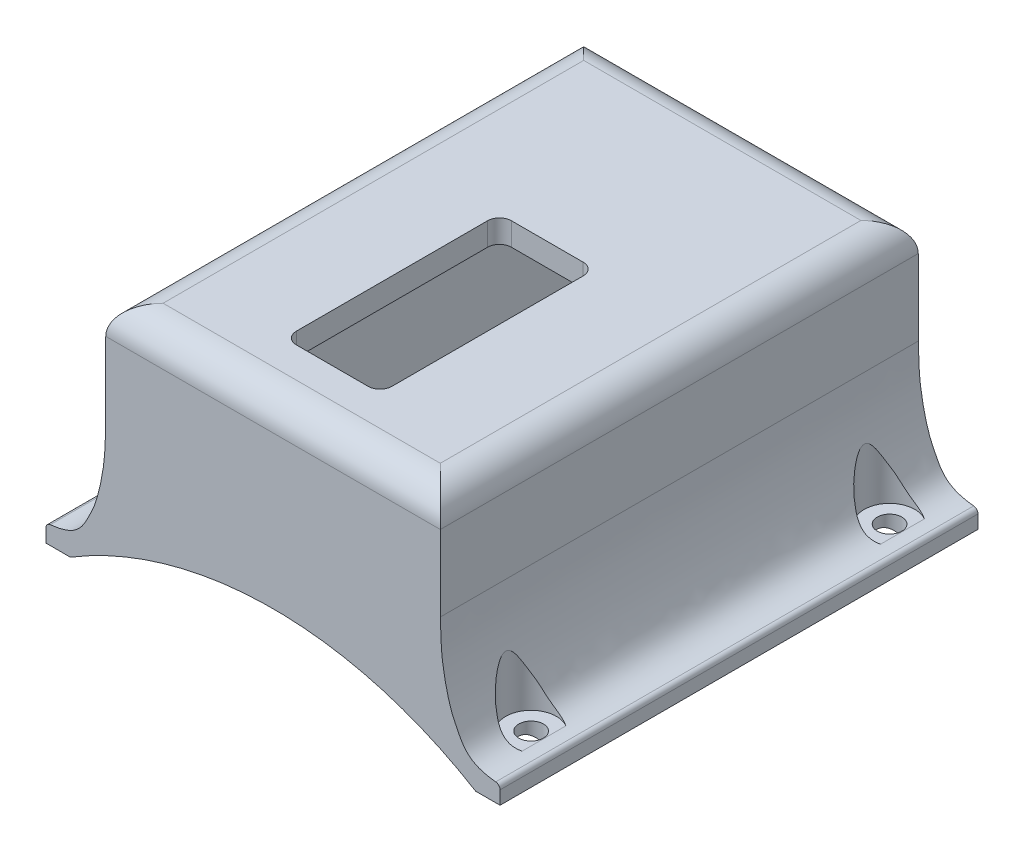
from build123d import *

# Parameters (mm, degrees)
SKETCH1_W                                           = 44.45
SKETCH1_H                                           = 63.5
BOSS_EXTRUDE1_DEPTH                                 = 27.7622
SKETCH3_W                                           = 38.608
SKETCH3_H                                           = 56.515
CUT_EXTRUDE2_DEPTH                                  = 24.7142
CUT_EXTRUDE3_DEPTH                                  = 3.175
BOSS_EXTRUDE2_DEPTH                                 = 63.5
FILLET1_R                                           = 3.81
SKETCH5_R                                           = 51.816
CUT_EXTRUDE6_DEPTH                                  = 76.582843155
FILLET4_R                                           = 0.635
CBORE_FOR_4_BINDING_HEAD_MACHINE_SCREW2_D           = 3.2639
CBORE_FOR_4_BINDING_HEAD_MACHINE_SCREW2_CBORE_D     = 6.74624
CBORE_FOR_4_BINDING_HEAD_MACHINE_SCREW2_CBORE_DEPTH = 28.9052
FILLET5_R                                           = 2.54
CUT_EXTRUDE7_REACH                                  = 55.987
SKETCH20_W                                          = 12.7
SKETCH20_H                                          = 28.575
FILLET6_R                                           = 1.5875


with BuildPart() as part:
    # Sketch1 → Boss-Extrude1 (new body)
    with BuildSketch(Plane(origin=(0, 0, 0), x_dir=(1, 0, 0), z_dir=(0, 1, 0))):
        Rectangle(SKETCH1_W, SKETCH1_H)
    extrude(amount=BOSS_EXTRUDE1_DEPTH)

    # Sketch3 → Cut-Extrude2 (cut)
    with BuildSketch(Plane.XZ):
        with Locations((0, -0.3175)):
            Rectangle(SKETCH3_W, SKETCH3_H)
    extrude(amount=-CUT_EXTRUDE2_DEPTH, mode=Mode.SUBTRACT)

    # Sketch2 → Cut-Extrude3 (cut)
    with BuildSketch(Plane(origin=(0, 0, -31.75), x_dir=(-1, 0, 0), z_dir=(0, 0, -1))):
        with BuildLine():
            Line((-14.2875, 1.721384113), (-14.2875, 15.795103523))
            ThreePointArc((-14.2875, 15.795103523), (-13.171576836, 18.489180359), (-10.4775, 19.605103523))
            ThreePointArc((-10.4775, 19.605103523), (-8.989602448, 23.197205971), (-5.3975, 24.685103523))
            Line((-5.3975, 24.685103523), (5.3975, 24.685103523))
            ThreePointArc((5.3975, 24.685103523), (8.989602448, 23.197205971), (10.4775, 19.605103523))
            ThreePointArc((10.4775, 19.605103523), (13.171576836, 18.489180359), (14.2875, 15.795103523))
            Line((14.2875, 15.795103523), (14.2875, 1.721384113))
            ThreePointArc((14.2875, 1.721384113), (0, 3.730103523), (-14.2875, 1.721384113))
        make_face()
    extrude(amount=-CUT_EXTRUDE3_DEPTH, mode=Mode.SUBTRACT)

    # Sketch6 → Boss-Extrude2 (add)
    with BuildSketch(Plane(origin=(0, 0, -31.75), x_dir=(-1, 0, 0), z_dir=(0, 0, -1))):
        with BuildLine():
            Line((-22.225, 0), (-22.225, 13.8811))
            add(Edge.make_bspline(
                [(-22.225, 13.8811), (-22.309526417, 11.734750223), (-22.293422752, 9.349499778), (-23.34420923, 4.426825654), (-25.231297733, 0.555602821), (-26.011933426, -1.181256587), (-30.1625, -1.448290471)],
                knots=[0, 0, 0, 0, 0.208478227, 0.455523902, 0.521662722, 1, 1, 1, 1], degree=3))
            Line((-30.1625, -1.448290471), (-30.1625, -3.81))
            Line((-30.1625, -3.81), (30.1625, -3.81))
            Line((30.1625, -3.81), (30.1625, -1.448290471))
            add(Edge.make_bspline(
                [(22.225, 13.8811), (22.309526417, 11.734750223), (22.293422752, 9.349499778), (23.34420923, 4.426825654), (25.231297733, 0.555602821), (26.011933426, -1.181256587), (30.1625, -1.448290471)],
                knots=[0, 0, 0, 0, 0.208478227, 0.455523902, 0.521662722, 1, 1, 1, 1], degree=3))
            Line((22.225, 13.8811), (22.225, 0))
            Line((22.225, 0), (-22.225, 0))
        make_face()
    extrude(amount=-BOSS_EXTRUDE2_DEPTH)

    # Fillet1
    # the kernel refuses this fillet: 3.81 mm, written as the material it takes off along each edge
    with BuildSketch(Plane(origin=(31.75, 27.7622, 31.75), x_dir=(0, -1, 0), z_dir=(-1, 0, 0))) as fillet1_piece_1:
        with BuildLine():
            CenterArc((FILLET1_R, -FILLET1_R), FILLET1_R, 90, 90)
            Line((0, -FILLET1_R), (0, 0))
            Line((0, 0), (FILLET1_R, 0))
        make_face()
    extrude(amount=63.5, mode=Mode.SUBTRACT)
    with BuildSketch(Plane(origin=(-22.225, 27.7622, 41.275), x_dir=(0, -1, 0), z_dir=(0, 0, -1)), Plane(origin=(22.225, 27.7622, -41.275), x_dir=(0, -1, 0), z_dir=(0, 0, 1))) as fillet1_piece_2:
        with BuildLine():
            CenterArc((FILLET1_R, -FILLET1_R), FILLET1_R, 90, 90)
            Line((0, -FILLET1_R), (0, 0))
            Line((0, 0), (FILLET1_R, 0))
        make_face()
    extrude(amount=82.55, mode=Mode.SUBTRACT)
    with BuildSketch(Plane(origin=(-31.75, 27.7622, -31.75), x_dir=(0, 0, 1), z_dir=(1, 0, 0))) as fillet1_piece_3:
        with BuildLine():
            CenterArc((FILLET1_R, FILLET1_R), FILLET1_R, 180, 90)
            Line((0, FILLET1_R), (0, 0))
            Line((0, 0), (FILLET1_R, 0))
        make_face()
    extrude(amount=63.5, mode=Mode.SUBTRACT)

    # Sketch5 → Cut-Extrude6 (cut, through all)
    with BuildSketch(Plane(origin=(0, 0, -31.75), x_dir=(-1, 0, 0), z_dir=(0, 0, -1))):
        with Locations((0, -48.085896477)):
            Circle(SKETCH5_R)
    extrude(amount=-CUT_EXTRUDE6_DEPTH, mode=Mode.SUBTRACT)

    # Fillet4
    fillet4_edges = [part.edges().sort_by_distance(p)[0] for p in [
        (-30.1625, -1.448290471, 0),
        (30.1625, -1.448290471, 0),
    ]]
    fillet(fillet4_edges, radius=FILLET4_R)

    # CBORE for #4 Binding Head Machine Screw2 (through all)
    with Locations(Plane(origin=(0, 27.7622, 0), x_dir=(1, 0, 0), z_dir=(0, 1, 0))):
        with Locations((-26.3525, 23.8125), (-26.3525, -23.8125), (26.3525, -23.8125), (26.3525, 23.8125)):
            CounterBoreHole(CBORE_FOR_4_BINDING_HEAD_MACHINE_SCREW2_D / 2, CBORE_FOR_4_BINDING_HEAD_MACHINE_SCREW2_CBORE_D / 2, CBORE_FOR_4_BINDING_HEAD_MACHINE_SCREW2_CBORE_DEPTH)

    # Fillet5
    fillet5_edges = [part.edges().sort_by_distance(p)[0] for p in [
        (10.4775, 19.605103523, -30.1625),
        (-10.4775, 19.605103523, -30.1625),
    ]]
    fillet(fillet5_edges, radius=FILLET5_R)

    # Sketch20 → Cut-Extrude7 (cut, up to next)
    with BuildSketch(Plane(origin=(0, 27.7622, 0), x_dir=(1, 0, 0), z_dir=(0, 1, 0)), mode=Mode.PRIVATE) as cut_extrude7_sk1:
        with Locations((0, -9.596156272)):
            Rectangle(SKETCH20_W, SKETCH20_H)
    cut_extrude7_tool1 = extrude(cut_extrude7_sk1.sketch, amount=-CUT_EXTRUDE7_REACH, mode=Mode.PRIVATE) & part.part
    add(cut_extrude7_tool1.solids().sort_by_distance((0, 27.7622, 9.596156))[0], mode=Mode.SUBTRACT)

    # Fillet6
    fillet6_edges = [part.edges().sort_by_distance(p)[0] for p in [
        (6.35, 26.2382, -4.691343728),
        (6.35, 26.2382, 23.883656272),
        (-6.35, 26.2382, 23.883656272),
        (-6.35, 26.2382, -4.691343728),
    ]]
    fillet(fillet6_edges, radius=FILLET6_R)


solid = part.part
